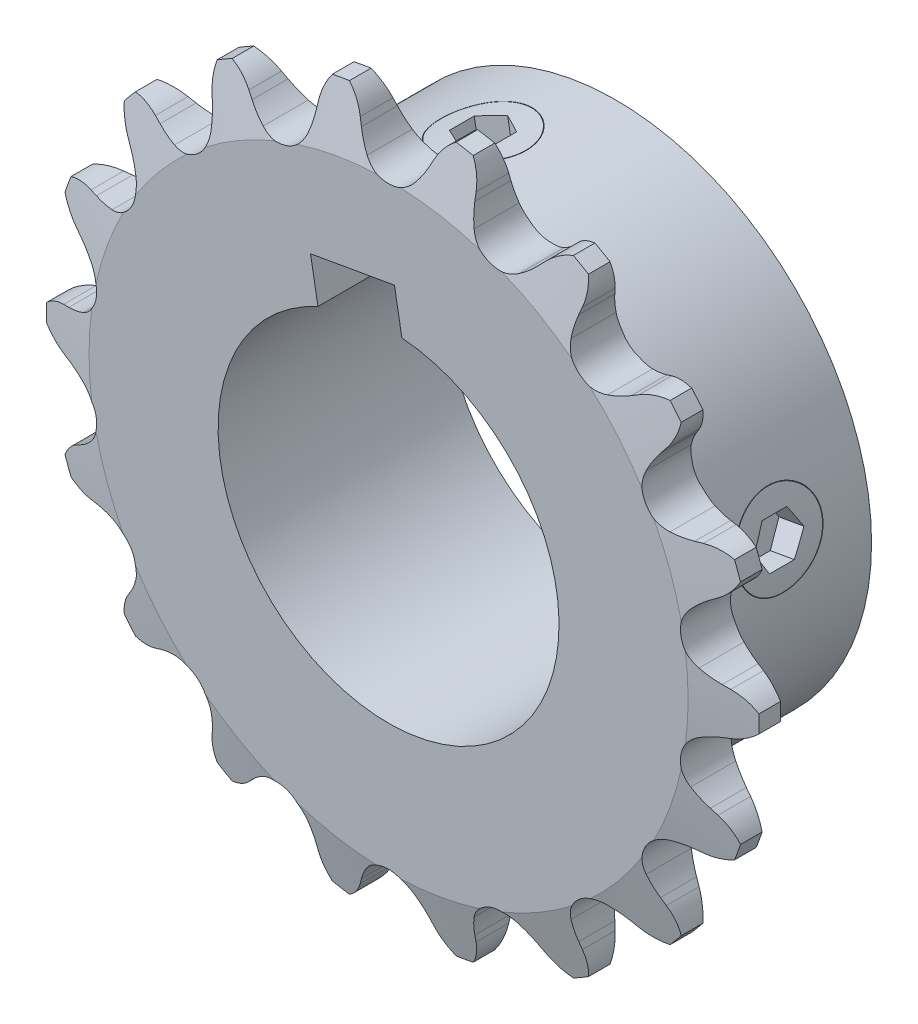
from build123d import *

# Parameters (mm, degrees)
TOOTH_CUT_NUMBER_OF_TEETH_18_DEPTH = 29.19349073
TOOTH_PATTERN_18_18_COUNT          = 18
SKETCH3_W                          = 9.906
SKETCH3_H                          = 14.2875
SKETCH4_R                          = 9.525
CUT_EXTRUDE1_DEPTH                 = 31.74639659
CUT_EXTRUDE2_DEPTH                 = 31.74639659
SKETCH7_R                          = 2.38125
CUT_EXTRUDE3_DEPTH                 = 40.707078286
CUT_EXTRUDE3_TAPER                 = -1
EXTRUDE1_REACH                     = 41.707
EXTRUDE1_END_RADIUS                = 14.2875
SKETCH8_R                          = 2.402863687
CUT_EXTRUDE4_START                 = -1.27
CUT_EXTRUDE4_DEPTH                 = 39.437078314
CIRPATTERN1_COUNT                  = 2
CIRPATTERN1_ANGLE                  = 90


with BuildPart() as part:
    # Sprocket-BaseSketch → 25 (04C) ANSI (ISO) Chain Number, 1.440in P.D. (revolve)
    with BuildSketch(Plane(origin=(0, 0, 0), x_dir=(0, 0, -1), z_dir=(1, 0, 0))):
        Polygon((1.397, 0), (1.397, 16.736319777), (0.60325, 19.911319777), (-0.60325, 19.911319777), (-1.397, 16.736319777), (-1.397, 0), align=None)
    revolve(axis=Axis((0, 0, -5.588), (0, 0, 1)))

    # Tooth-Sketch → Tooth-Cut, Number of teeth: 18 (cut, symmetric)
    with BuildSketch(Plane.XY):
        with BuildLine():
            Line((1.908645709, 18.196215131), (2.066224101, 18.559583724))
            ThreePointArc((2.066224101, 18.559583724), (3.065556725, 19.747030253), (4.552569281, 20.191427162))
            ThreePointArc((4.552569281, 20.191427162), (0, 20.69829988), (-4.552569281, 20.191427162))
            ThreePointArc((-4.552569281, 20.191427162), (-3.065556725, 19.747030253), (-2.066224101, 18.559583724))
            Line((-2.066224101, 18.559583724), (-1.908645709, 18.196215131))
            ThreePointArc((-1.908645709, 18.196215131), (-1.651424634, 17.695000021), (-1.331431851, 17.231336472))
            ThreePointArc((-1.331431851, 17.231336472), (0, 16.586741284), (1.331431851, 17.231336472))
            ThreePointArc((1.331431851, 17.231336472), (1.651424634, 17.695000021), (1.908645709, 18.196215131))
        make_face()
    tooth_cut_number_of_teeth_18 = extrude(amount=TOOTH_CUT_NUMBER_OF_TEETH_18_DEPTH, both=True, mode=Mode.SUBTRACT)

    # Tooth Pattern, 18 / 18: Tooth-Cut, Number of teeth: 18 ×18 about axis
    tooth_pattern_18_18_axis = Axis((0, 0, -88.99), (0, 0, 1))
    for i in range(1, TOOTH_PATTERN_18_18_COUNT):
        add(tooth_cut_number_of_teeth_18.rotate(tooth_pattern_18_18_axis, i * 360 / TOOTH_PATTERN_18_18_COUNT), mode=Mode.SUBTRACT)

    # Sketch3 → Hub-Revolve1 (revolve)
    with BuildSketch(Plane(origin=(0, 0, 0), x_dir=(0, 0, -1), z_dir=(1, 0, 0))):
        with Locations((6.35, 7.14375)):
            Rectangle(SKETCH3_W, SKETCH3_H)
    revolve(axis=Axis((0, 0, 9.906), (0, 0, -1)))

    # Sketch4 → Cut-Extrude1 (cut, through all)
    with BuildSketch(Plane(origin=(0, 0, -11.303), x_dir=(-1, 0, 0), z_dir=(0, 0, -1))):
        Circle(SKETCH4_R)
    extrude(amount=-CUT_EXTRUDE1_DEPTH, mode=Mode.SUBTRACT)

    # Sketch6 → Cut-Extrude2 (cut, through all)
    with BuildSketch(Plane(origin=(0, 0, -11.303), x_dir=(-1, 0, 0), z_dir=(0, 0, -1))):
        Polygon((-0.743595921, 9.495930186), (-0.330096198, 11.841003648), (4.360050726, 11.014004202), (3.946551003, 8.66893074), align=None)
    extrude(amount=-CUT_EXTRUDE2_DEPTH, mode=Mode.SUBTRACT)

    # Sketch7 → Cut-Extrude3 (cut, through all)
    with BuildSketch(Plane(origin=(-2.014977264, 11.427503925, 0), x_dir=(0.9848077530122081, 0.17364817766693008, 0), z_dir=(0.17364817766693008, -0.9848077530122081, 0))):
        with Locations((0, -6.35)):
            Circle(SKETCH7_R)
    cut_extrude3 = extrude(amount=-CUT_EXTRUDE3_DEPTH, taper=CUT_EXTRUDE3_TAPER, mode=Mode.SUBTRACT)

    # Extrude1: up to this cylinder (the profile starts inside it)
    extrude1_end = Plane(origin=(0, 0, -6.35), z_dir=(0, 0, 1)) * Cylinder(EXTRUDE1_END_RADIUS, 112.989, mode=Mode.PRIVATE)
    # Sketch8 → Extrude1 (add, up to the surface)
    with BuildSketch(Plane(origin=(-2.014977264, 11.427503925, 0), x_dir=(0.9848077530122081, 0.17364817766693008, 0), z_dir=(0.17364817766693008, -0.9848077530122081, 0)), mode=Mode.PRIVATE) as extrude1_sk1:
        with Locations((0, -6.35)):
            Circle(SKETCH8_R)
    extrude1_tool1 = extrude(extrude1_sk1.sketch, amount=-EXTRUDE1_REACH, mode=Mode.PRIVATE) & extrude1_end
    extrude1 = extrude1_tool1.solids().sort_by_distance((-2.014977, 11.427504, -6.35))[0]
    add(extrude1)

    # Sketch9 → Cut-Extrude4 (cut, through all)
    with BuildSketch(Plane(origin=(-2.014977264, 11.427503925, 0), x_dir=(0.9848077530122081, 0.17364817766693008, 0), z_dir=(0.17364817766693008, -0.9848077530122081, 0)).offset(CUT_EXTRUDE4_START)):
        Polygon((0, -7.737293997), (1.201431844, -7.043646998), (1.201431844, -5.656353002), (0, -4.962706003), (-1.201431844, -5.656353002), (-1.201431844, -7.043646998), align=None)
    cut_extrude4 = extrude(amount=-CUT_EXTRUDE4_DEPTH, mode=Mode.SUBTRACT)

    # CirPattern1: Cut-Extrude3, Extrude1, Cut-Extrude4 ×2 about axis
    cirpattern1_axis = Axis((0, 0, 9.906), (0, 0, -1))
    add([cut_extrude3.rotate(cirpattern1_axis, i * CIRPATTERN1_ANGLE / (CIRPATTERN1_COUNT - 1)) for i in range(1, CIRPATTERN1_COUNT)], mode=Mode.SUBTRACT)
    add([extrude1.rotate(cirpattern1_axis, i * CIRPATTERN1_ANGLE / (CIRPATTERN1_COUNT - 1)) for i in range(1, CIRPATTERN1_COUNT)])
    add([cut_extrude4.rotate(cirpattern1_axis, i * CIRPATTERN1_ANGLE / (CIRPATTERN1_COUNT - 1)) for i in range(1, CIRPATTERN1_COUNT)], mode=Mode.SUBTRACT)


solid = part.part
